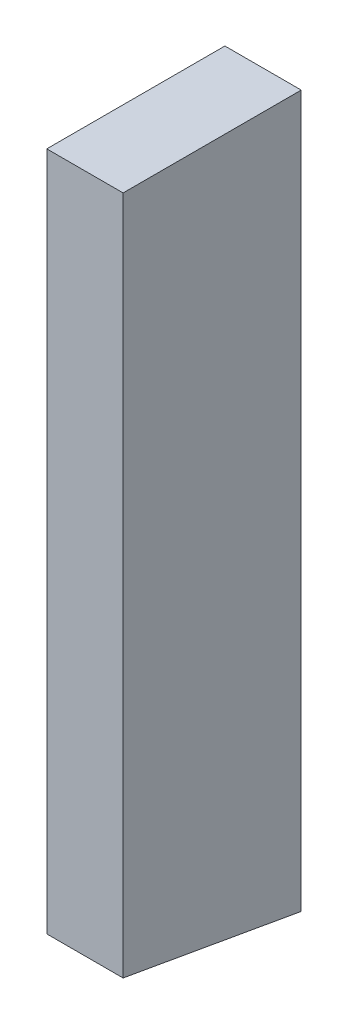
from build123d import *

# Parameters (mm, degrees)
SKETCH1_W           = 38.1
SKETCH1_H           = 88.9
BOSS_EXTRUDE1_DEPTH = 355
CUT_EXTRUDE1_REACH  = 361.795


with BuildPart() as part:
    # Sketch1 → Boss-Extrude1 (new body)
    with BuildSketch(Plane(origin=(0, 0, 0), x_dir=(1, 0, 0), z_dir=(0, 1, 0))):
        Rectangle(SKETCH1_W, SKETCH1_H)
    extrude(amount=BOSS_EXTRUDE1_DEPTH)

    # Sketch2 → Cut-Extrude1 (cut, up to next)
    with BuildSketch(Plane.ZY.offset(19.05), mode=Mode.PRIVATE) as cut_extrude1_sk1:
        Polygon((-44.45, 0), (44.45, 15.675468585), (44.45, 0), align=None)
    cut_extrude1_tool1 = extrude(cut_extrude1_sk1.sketch, amount=-CUT_EXTRUDE1_REACH, mode=Mode.PRIVATE) & part.part
    add(cut_extrude1_tool1.solids().sort_by_distance((-19.05, 5.225156, 14.816667))[0], mode=Mode.SUBTRACT)


solid = part.part
